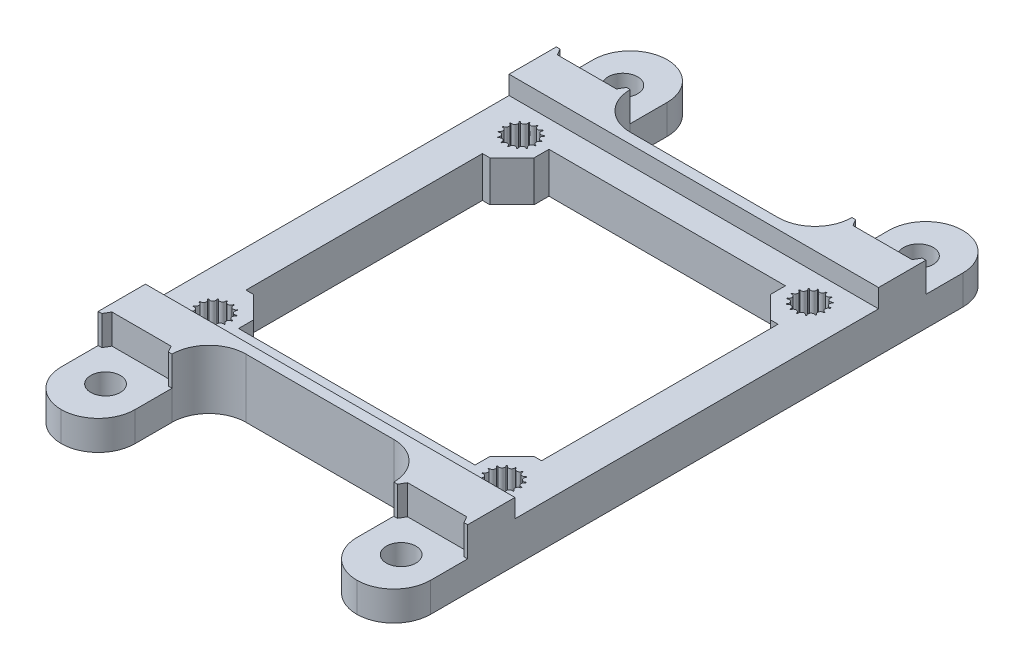
from build123d import *

# Parameters (mm, degrees)
SKETCH1_W                                  = 50
SKETCH1_H                                  = 52
BOSS_EXTRUDE1_DEPTH                        = 8
CUT_EXTRUDE1_DEPTH                         = 8
MIRROR1_AT_THE_SECOND_PLANE_COPY_1_DEPTH   = 8
SKETCH3_W                                  = 10
SKETCH3_H                                  = 15
SKETCH3_R                                  = 2
BOSS_EXTRUDE2_DEPTH                        = 8
MIRROR2_AT_THE_SECOND_PLANE_COPY_1_SKETC_W = 10
MIRROR2_AT_THE_SECOND_PLANE_COPY_1_SKETC_H = 15
MIRROR2_AT_THE_SECOND_PLANE_COPY_1_SKETC_R = 2
MIRROR2_AT_THE_SECOND_PLANE_COPY_1_DEPTH   = 8
FILLET1_R                                  = 5
CUT_EXTRUDE2_DEPTH                         = 4
MIRROR4_AT_THE_SECOND_PLANE_COPY_1_DEPTH   = 4
SKETCH5_W                                  = 40
SKETCH5_H                                  = 32
CUT_EXTRUDE3_DEPTH                         = 13
SKETCH6_W                                  = 50
SKETCH6_H                                  = 49.2
CUT_EXTRUDE4_DEPTH                         = 2.5
SKETCH7_W                                  = 32
SKETCH7_H                                  = 42
CUT_EXTRUDE5_DEPTH                         = 10
CHAMFER1_SIZE                              = 3
MIRROR8_DEPTH                              = 5.5


# Read off the part's stored shape, not the designer's step: Mirror8
with BuildPart() as part:
    # Sketch1 → Boss-Extrude1 (new body)
    with BuildSketch(Plane(origin=(0, 0, 0), x_dir=(1, 0, 0), z_dir=(0, 1, 0))):
        with Locations((25, 26)):
            Rectangle(SKETCH1_W, SKETCH1_H)
    extrude(amount=BOSS_EXTRUDE1_DEPTH)

    # Sketch2 → Cut-Extrude1 (cut)
    with BuildSketch(Plane(origin=(0, 8, 0), x_dir=(1, 0, 0), z_dir=(0, 1, 0))):
        with BuildLine():
            ThreePointArc((7.610667609, 4.622293474), (7.289865506, 5.056622343), (7.693959363, 5.414761577))
            ThreePointArc((7.693959363, 5.414761577), (7.687674265, 5.485189042), (7.679179325, 5.555384245))
            ThreePointArc((7.679179325, 5.555384245), (7.209454555, 5.82168144), (7.432944313, 6.313217688))
            ThreePointArc((7.432944313, 6.313217688), (7.398557159, 6.375), (7.362245684, 6.435671305))
            ThreePointArc((7.362245684, 6.435671305), (6.824817927, 6.487891622), (6.829060176, 7.027833803))
            ThreePointArc((6.829060176, 7.027833803), (6.772516818, 7.070288237), (6.714667392, 7.110945025))
            ThreePointArc((6.714667392, 7.110945025), (6.20246279, 6.940059097), (5.986724007, 7.435046302))
            ThreePointArc((5.986724007, 7.435046302), (5.917801304, 7.450832102), (5.848416619, 7.464444444))
            ThreePointArc((5.848416619, 7.464444444), (5.45, 7.1), (5.051583381, 7.464444444))
            ThreePointArc((5.051583381, 7.464444444), (4.982198696, 7.450832102), (4.913275993, 7.435046302))
            ThreePointArc((4.913275993, 7.435046302), (4.929414078, 7.371153089), (4.934842553, 7.30547728))
            ThreePointArc((4.934842553, 7.30547728), (4.635331413, 6.918305497), (4.185332608, 7.110945025))
            ThreePointArc((4.185332608, 7.110945025), (4.127483182, 7.070288237), (4.070939824, 7.027833803))
            ThreePointArc((4.070939824, 7.027833803), (4.150218564, 6.901820533), (4.177924143, 6.755543864))
            ThreePointArc((4.177924143, 6.755543864), (3.95671462, 6.397725523), (3.537754316, 6.435671305))
            ThreePointArc((3.537754316, 6.435671305), (3.501442841, 6.375), (3.467055687, 6.313217688))
            ThreePointArc((3.467055687, 6.313217688), (3.643869104, 6.165772772), (3.710122838, 5.945288237))
            ThreePointArc((3.710122838, 5.945288237), (3.559400931, 5.632461716), (3.220820675, 5.555384245))
            ThreePointArc((3.220820675, 5.555384245), (3.212325735, 5.485189042), (3.206040637, 5.414761577))
            ThreePointArc((3.206040637, 5.414761577), (3.492937532, 5.299867127), (3.612325735, 5.014810958))
            ThreePointArc((3.612325735, 5.014810958), (3.521196794, 4.760648276), (3.289332391, 4.622293474))
            ThreePointArc((3.289332391, 4.622293474), (3.310122838, 4.554711763), (3.333026546, 4.487816691))
            ThreePointArc((3.333026546, 4.487816691), (3.716656087, 4.462169481), (3.901442841, 4.125))
            ThreePointArc((3.901442841, 4.125), (3.85640772, 3.940609287), (3.731443165, 3.797738864))
            ThreePointArc((3.731443165, 3.797738864), (3.777924143, 3.744456136), (3.826056398, 3.692660224))
            ThreePointArc((3.826056398, 3.692660224), (4.267892025, 3.804258631), (4.527483182, 3.429711763))
            ThreePointArc((4.527483182, 3.429711763), (4.513028211, 3.323151777), (4.470708029, 3.224293398))
            ThreePointArc((4.470708029, 3.224293398), (4.534842553, 3.19452272), (4.599880851, 3.166781953))
            ThreePointArc((4.599880851, 3.166781953), (5.041666595, 3.444722659), (5.382198696, 3.049167898))
            ThreePointArc((5.382198696, 3.049167898), (5.381473708, 3.025095823), (5.379301372, 3.001111007))
            ThreePointArc((5.379301372, 3.001111007), (5.45, 3), (5.520698628, 3.001111007))
            ThreePointArc((5.520698628, 3.001111007), (5.834636628, 3.440426939), (6.300119149, 3.166781953))
            ThreePointArc((6.300119149, 3.166781953), (6.365157447, 3.19452272), (6.429291971, 3.224293398))
            ThreePointArc((6.429291971, 3.224293398), (6.537402717, 3.75331856), (7.073943602, 3.692660224))
            ThreePointArc((7.073943602, 3.692660224), (7.122075857, 3.744456136), (7.168556835, 3.797738864))
            ThreePointArc((7.168556835, 3.797738864), (7.052146997, 4.325), (7.566973454, 4.487816691))
            ThreePointArc((7.566973454, 4.487816691), (7.589877162, 4.554711763), (7.610667609, 4.622293474))
        make_face()
    cut_extrude1 = extrude(amount=-CUT_EXTRUDE1_DEPTH, mode=Mode.SUBTRACT)

    # Mirror1: Cut-Extrude1 across plane
    add(cut_extrude1.mirror(Plane(origin=(0, 0, -26), x_dir=(1, 0, 0), z_dir=(0, 0, -1))), mode=Mode.SUBTRACT)

    # Mirror1 at the second plane: Cut-Extrude1 across plane
    add(cut_extrude1.mirror(Plane.ZY.offset(-25)), mode=Mode.SUBTRACT)

    # Mirror1 at the second plane copy 1 sketc → Mirror1 at the second plane copy 1 (cut)
    with BuildSketch(Plane(origin=(50, 8, -52), x_dir=(-1, 0, 0), z_dir=(0, 1, 0))):
        with BuildLine():
            ThreePointArc((7.610667609, 4.622293474), (7.289865506, 5.056622343), (7.693959363, 5.414761577))
            ThreePointArc((7.693959363, 5.414761577), (7.687674265, 5.485189042), (7.679179325, 5.555384245))
            ThreePointArc((7.679179325, 5.555384245), (7.209454555, 5.82168144), (7.432944313, 6.313217688))
            ThreePointArc((7.432944313, 6.313217688), (7.398557159, 6.375), (7.362245684, 6.435671305))
            ThreePointArc((7.362245684, 6.435671305), (6.824817927, 6.487891622), (6.829060176, 7.027833803))
            ThreePointArc((6.829060176, 7.027833803), (6.772516818, 7.070288237), (6.714667392, 7.110945025))
            ThreePointArc((6.714667392, 7.110945025), (6.20246279, 6.940059097), (5.986724007, 7.435046302))
            ThreePointArc((5.986724007, 7.435046302), (5.917801304, 7.450832102), (5.848416619, 7.464444444))
            ThreePointArc((5.848416619, 7.464444444), (5.45, 7.1), (5.051583381, 7.464444444))
            ThreePointArc((5.051583381, 7.464444444), (4.982198696, 7.450832102), (4.913275993, 7.435046302))
            ThreePointArc((4.913275993, 7.435046302), (4.929414078, 7.371153089), (4.934842553, 7.30547728))
            ThreePointArc((4.934842553, 7.30547728), (4.635331413, 6.918305497), (4.185332608, 7.110945025))
            ThreePointArc((4.185332608, 7.110945025), (4.127483182, 7.070288237), (4.070939824, 7.027833803))
            ThreePointArc((4.070939824, 7.027833803), (4.150218564, 6.901820533), (4.177924143, 6.755543864))
            ThreePointArc((4.177924143, 6.755543864), (3.95671462, 6.397725523), (3.537754316, 6.435671305))
            ThreePointArc((3.537754316, 6.435671305), (3.501442841, 6.375), (3.467055687, 6.313217688))
            ThreePointArc((3.467055687, 6.313217688), (3.643869104, 6.165772772), (3.710122838, 5.945288237))
            ThreePointArc((3.710122838, 5.945288237), (3.559400931, 5.632461716), (3.220820675, 5.555384245))
            ThreePointArc((3.220820675, 5.555384245), (3.212325735, 5.485189042), (3.206040637, 5.414761577))
            ThreePointArc((3.206040637, 5.414761577), (3.492937532, 5.299867127), (3.612325735, 5.014810958))
            ThreePointArc((3.612325735, 5.014810958), (3.521196794, 4.760648276), (3.289332391, 4.622293474))
            ThreePointArc((3.289332391, 4.622293474), (3.310122838, 4.554711763), (3.333026546, 4.487816691))
            ThreePointArc((3.333026546, 4.487816691), (3.716656087, 4.462169481), (3.901442841, 4.125))
            ThreePointArc((3.901442841, 4.125), (3.85640772, 3.940609287), (3.731443165, 3.797738864))
            ThreePointArc((3.731443165, 3.797738864), (3.777924143, 3.744456136), (3.826056398, 3.692660224))
            ThreePointArc((3.826056398, 3.692660224), (4.267892025, 3.804258631), (4.527483182, 3.429711763))
            ThreePointArc((4.527483182, 3.429711763), (4.513028211, 3.323151777), (4.470708029, 3.224293398))
            ThreePointArc((4.470708029, 3.224293398), (4.534842553, 3.19452272), (4.599880851, 3.166781953))
            ThreePointArc((4.599880851, 3.166781953), (5.041666595, 3.444722659), (5.382198696, 3.049167898))
            ThreePointArc((5.382198696, 3.049167898), (5.381473708, 3.025095823), (5.379301372, 3.001111007))
            ThreePointArc((5.379301372, 3.001111007), (5.45, 3), (5.520698628, 3.001111007))
            ThreePointArc((5.520698628, 3.001111007), (5.834636628, 3.440426939), (6.300119149, 3.166781953))
            ThreePointArc((6.300119149, 3.166781953), (6.365157447, 3.19452272), (6.429291971, 3.224293398))
            ThreePointArc((6.429291971, 3.224293398), (6.537402717, 3.75331856), (7.073943602, 3.692660224))
            ThreePointArc((7.073943602, 3.692660224), (7.122075857, 3.744456136), (7.168556835, 3.797738864))
            ThreePointArc((7.168556835, 3.797738864), (7.052146997, 4.325), (7.566973454, 4.487816691))
            ThreePointArc((7.566973454, 4.487816691), (7.589877162, 4.554711763), (7.610667609, 4.622293474))
        make_face()
    extrude(amount=-MIRROR1_AT_THE_SECOND_PLANE_COPY_1_DEPTH, mode=Mode.SUBTRACT)

    # Sketch3 → Boss-Extrude2 (add)
    with BuildSketch(Plane(origin=(0, 8, 0), x_dir=(1, 0, 0), z_dir=(0, 1, 0))):
        with Locations((5, -7.5)):
            Rectangle(SKETCH3_W, SKETCH3_H)
        with Locations(Location((5, -9, 0), (0, 0, 270))):
            Circle(SKETCH3_R, mode=Mode.SUBTRACT)
    boss_extrude2 = extrude(amount=-BOSS_EXTRUDE2_DEPTH)

    # Mirror2: Boss-Extrude2 across plane
    add(boss_extrude2.mirror(Plane(origin=(0, 0, -26), x_dir=(1, 0, 0), z_dir=(0, 0, -1))))

    # Mirror2 at the second plane: Boss-Extrude2 across plane
    add(boss_extrude2.mirror(Plane.ZY.offset(-25)))

    # Mirror2 at the second plane copy 1 sketc → Mirror2 at the second plane copy 1 (add)
    with BuildSketch(Plane(origin=(50, 8, -52), x_dir=(-1, 0, 0), z_dir=(0, 1, 0))):
        with Locations((5, -7.5)):
            Rectangle(MIRROR2_AT_THE_SECOND_PLANE_COPY_1_SKETC_W, MIRROR2_AT_THE_SECOND_PLANE_COPY_1_SKETC_H)
        with Locations(Location((5, -9, 0), (0, 0, 270))):
            Circle(MIRROR2_AT_THE_SECOND_PLANE_COPY_1_SKETC_R, mode=Mode.SUBTRACT)
    extrude(amount=-MIRROR2_AT_THE_SECOND_PLANE_COPY_1_DEPTH)

    # Fillet1
    fillet1_edges = [part.edges().sort_by_distance(p)[0] for p in [
        (0, 4, 15),
        (10, 4, 0),
        (10, 4, 15),
        (50, 4, 15),
        (40, 4, 15),
        (40, 4, 0),
        (0, 4, -67),
        (10, 4, -67),
        (10, 4, -52),
        (50, 4, -67),
        (40, 4, -52),
        (40, 4, -67),
    ]]
    fillet(fillet1_edges, radius=FILLET1_R - 0.0001)  # a hair under: the kernel refuses the full size

    # Sketch4 → Cut-Extrude2 (cut)
    with BuildSketch(Plane(origin=(0, 8, 0), x_dir=(1, 0, 0), z_dir=(0, 1, 0))):
        Polygon((1, -4.133974596), (0.5, -5), (0, -5), (0, -18.620495432), (15, -18.620495432), (15, -5), (9.5, -5), (9, -4.133974596), align=None)
    cut_extrude2 = extrude(amount=-CUT_EXTRUDE2_DEPTH, mode=Mode.SUBTRACT)

    # Mirror4: Cut-Extrude2 across plane
    add(cut_extrude2.mirror(Plane(origin=(0, 0, -26), x_dir=(1, 0, 0), z_dir=(0, 0, -1))), mode=Mode.SUBTRACT)

    # Mirror4 at the second plane: Cut-Extrude2 across plane
    add(cut_extrude2.mirror(Plane.ZY.offset(-25)), mode=Mode.SUBTRACT)

    # Mirror4 at the second plane copy 1 sketc → Mirror4 at the second plane copy 1 (cut)
    with BuildSketch(Plane(origin=(50, 8, -52), x_dir=(-1, 0, 0), z_dir=(0, 1, 0))):
        Polygon((1, -4.133974596), (0.5, -5), (0, -5), (0, -18.620495432), (15, -18.620495432), (15, -5), (9.5, -5), (9, -4.133974596), align=None)
    extrude(amount=-MIRROR4_AT_THE_SECOND_PLANE_COPY_1_DEPTH, mode=Mode.SUBTRACT)

    # Sketch5 → Cut-Extrude3 (cut)
    with BuildSketch(Plane(origin=(0, 8, 0), x_dir=(1, 0, 0), z_dir=(0, 1, 0))):
        with Locations((25, 26)):
            Rectangle(SKETCH5_W, SKETCH5_H)
    extrude(amount=-CUT_EXTRUDE3_DEPTH, mode=Mode.SUBTRACT)

    # Sketch6 → Cut-Extrude4 (cut)
    with BuildSketch(Plane(origin=(0, 8, 0), x_dir=(1, 0, 0), z_dir=(0, 1, 0))):
        with Locations((25, 26)):
            Rectangle(SKETCH6_W, SKETCH6_H)
    extrude(amount=-CUT_EXTRUDE4_DEPTH, mode=Mode.SUBTRACT)

    # Sketch7 → Cut-Extrude5 (cut)
    with BuildSketch(Plane(origin=(0, 5.5, 0), x_dir=(1, 0, 0), z_dir=(0, 1, 0))):
        with Locations((25, 26)):
            Rectangle(SKETCH7_W, SKETCH7_H)
    extrude(amount=-CUT_EXTRUDE5_DEPTH, mode=Mode.SUBTRACT)

    # Chamfer1
    chamfer1_edges = [part.edges().sort_by_distance(p)[0] for p in [
        (41, 2.75, -10),
    ]]
    chamfer(chamfer1_edges, length=CHAMFER1_SIZE)

    # Mirror8 outline → Mirror8 (cut)
    with BuildSketch(Plane(origin=(0, 0, 0), x_dir=(1, 0, 0), z_dir=(0, 1, 0))):
        Polygon((9, 10), (6, 10), (9, 7), align=None)
        Polygon((41, 42), (44, 42), (41, 45), align=None)
        Polygon((9, 42), (9, 45), (6, 42), align=None)
    extrude(amount=MIRROR8_DEPTH, mode=Mode.SUBTRACT)


solid = part.part
